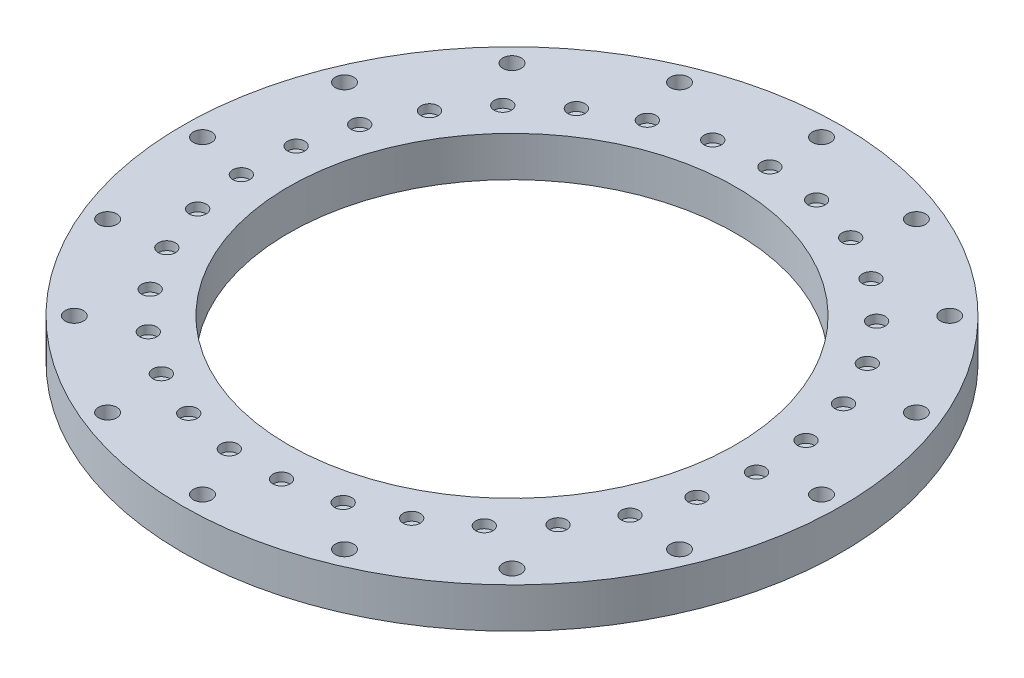
from build123d import *

# Parameters (mm, degrees)
SKETCH1_R           = 57.5
SKETCH1_R_2         = 39
BOSS_EXTRUDE1_DEPTH = 7
SKETCH2_R           = 1.6
CUT_EXTRUDE1_DEPTH  = 17
SKETCH3_R           = 1.5
CUT_EXTRUDE2_DEPTH  = 1.5


with BuildPart() as part:
    # Sketch1 → Boss-Extrude1 (new body)
    with BuildSketch(Plane(origin=(0, 0, 0), x_dir=(1, 0, 0), z_dir=(0, 1, 0))):
        Circle(SKETCH1_R)
        Circle(SKETCH1_R_2, mode=Mode.SUBTRACT)
    extrude(amount=BOSS_EXTRUDE1_DEPTH)

    # Sketch2 → Cut-Extrude1 (cut)
    with BuildSketch(Plane(origin=(0, 7, 0), x_dir=(1, 0, 0), z_dir=(0, 1, 0))):
        with Locations((0, 54)):
            Circle(SKETCH2_R)
        with Locations((20.664905348, 49.889494756)):
            Circle(SKETCH2_R)
        with Locations((38.183766184, 38.183766184)):
            Circle(SKETCH2_R)
        with Locations((49.889494756, 20.664905348)):
            Circle(SKETCH2_R)
        with Locations((54, 0)):
            Circle(SKETCH2_R)
        with Locations((49.889494756, -20.664905348)):
            Circle(SKETCH2_R)
        with Locations((38.183766184, -38.183766184)):
            Circle(SKETCH2_R)
        with Locations((20.664905348, -49.889494756)):
            Circle(SKETCH2_R)
        with Locations((0, -54)):
            Circle(SKETCH2_R)
        with Locations((-20.664905348, -49.889494756)):
            Circle(SKETCH2_R)
        with Locations((-38.183766184, -38.183766184)):
            Circle(SKETCH2_R)
        with Locations((-49.889494756, -20.664905348)):
            Circle(SKETCH2_R)
        with Locations((-54, 0)):
            Circle(SKETCH2_R)
        with Locations((-49.889494756, 20.664905348)):
            Circle(SKETCH2_R)
        with Locations((-38.183766184, 38.183766184)):
            Circle(SKETCH2_R)
        with Locations((-20.664905348, 49.889494756)):
            Circle(SKETCH2_R)
    extrude(amount=-CUT_EXTRUDE1_DEPTH, mode=Mode.SUBTRACT)

    # Sketch3 → Cut-Extrude2 (cut)
    with BuildSketch(Plane(origin=(0, 7, 0), x_dir=(1, 0, 0), z_dir=(0, 1, 0))):
        with Locations((0, 45)):
            Circle(SKETCH3_R)
        with Locations((9.058433404, 44.078847356)):
            Circle(SKETCH3_R)
        with Locations((17.74601348, 41.353101523)):
            Circle(SKETCH3_R)
        with Locations((25.707069679, 36.934354854)):
            Circle(SKETCH3_R)
        with Locations((32.615675425, 31.003511358)):
            Circle(SKETCH3_R)
        with Locations((38.188991587, 23.803380465)):
            Circle(SKETCH3_R)
        with Locations((42.198845947, 15.628736378)):
            Circle(SKETCH3_R)
        with Locations((44.481074595, 6.814249988)):
            Circle(SKETCH3_R)
        with Locations((44.942242823, -2.279212598)):
            Circle(SKETCH3_R)
        with Locations((43.563470349, -11.279363952)):
            Circle(SKETCH3_R)
        with Locations((40.401204281, -19.81773682)):
            Circle(SKETCH3_R)
        with Locations((35.584908162, -27.544769215)):
            Circle(SKETCH3_R)
        with Locations((29.311761723, -34.144115521)):
            Circle(SKETCH3_R)
        with Locations((21.838588314, -39.345597727)):
            Circle(SKETCH3_R)
        with Locations((13.471340534, -42.936266538)):
            Circle(SKETCH3_R)
        with Locations((4.552574489, -44.769119553)):
            Circle(SKETCH3_R)
        with Locations((-4.552574489, -44.769119553)):
            Circle(SKETCH3_R)
        with Locations((-13.471340534, -42.936266538)):
            Circle(SKETCH3_R)
        with Locations((-21.838588314, -39.345597727)):
            Circle(SKETCH3_R)
        with Locations((-29.311761722, -34.144115521)):
            Circle(SKETCH3_R)
        with Locations((-35.584908162, -27.544769215)):
            Circle(SKETCH3_R)
        with Locations((-40.401204281, -19.81773682)):
            Circle(SKETCH3_R)
        with Locations((-43.563470349, -11.279363952)):
            Circle(SKETCH3_R)
        with Locations((-44.942242823, -2.279212598)):
            Circle(SKETCH3_R)
        with Locations((-44.481074595, 6.814249988)):
            Circle(SKETCH3_R)
        with Locations((-42.198845947, 15.628736378)):
            Circle(SKETCH3_R)
        with Locations((-38.188991587, 23.803380465)):
            Circle(SKETCH3_R)
        with Locations((-32.615675425, 31.003511358)):
            Circle(SKETCH3_R)
        with Locations((-25.707069679, 36.934354854)):
            Circle(SKETCH3_R)
        with Locations((-17.74601348, 41.353101523)):
            Circle(SKETCH3_R)
        with Locations((-9.058433404, 44.078847356)):
            Circle(SKETCH3_R)
    extrude(amount=-CUT_EXTRUDE2_DEPTH, mode=Mode.SUBTRACT)


solid = part.part
